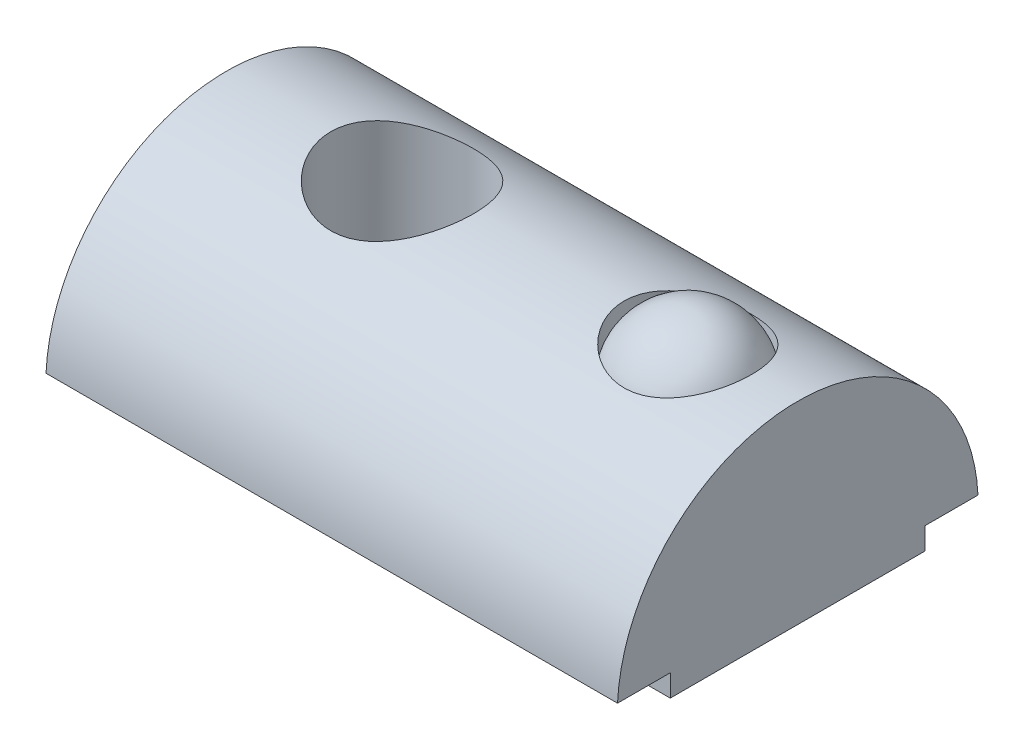
from build123d import *

# Parameters (mm, degrees)
BOSS_EXTRUDE1_DEPTH = 13
TAP1_D              = 3.242
DIAMETERHOLE1_D     = 2.9
BOSS_EXTRUDE2_REACH = 13.082
SKETCH7_R           = 1.45


with BuildPart() as part:
    # Sketch1 → Boss-Extrude1 (new body)
    with BuildSketch(Plane(origin=(-4, 0, 0), x_dir=(0, 0, -1), z_dir=(1, 0, 0))):
        with BuildLine():
            Line((4.1, 0.5), (2.9, 0.5))
            Line((2.9, 0.5), (2.9, 0))
            Line((2.9, 0), (-2.9, 0))
            Line((-2.9, 0), (-2.9, 0.5))
            Line((-2.9, 0.5), (-4.1, 0.5))
            ThreePointArc((-4.1, 0.5), (0, 4.4), (4.1, 0.5))
        make_face()
    extrude(amount=BOSS_EXTRUDE1_DEPTH)

    # Tap1 (through all)
    with Locations(Plane(origin=(0, 0, 0), x_dir=(-1, 0, 0), z_dir=(0, -1, 0))):
        with Locations((0, 0)):
            Hole(TAP1_D / 2)

    # DiameterHole1 (through all)
    with Locations(Plane(origin=(0, 0, 0), x_dir=(-1, 0, 0), z_dir=(0, -1, 0))):
        with Locations((-6.5, 0)):
            Hole(DIAMETERHOLE1_D / 2)

    # Sketch4 → Revolve1 (revolve)
    with BuildSketch(Plane(origin=(0, 0, 0), x_dir=(-1, 0, 0), z_dir=(0, 0, -1))):
        with BuildLine():
            Line((-6.5, 5), (-6.5, 2))
            ThreePointArc((-6.5, 2), (-5, 3.5), (-6.5, 5))
        make_face()
    revolve(axis=Axis((6.5, 5, 0), (0, -1, 0)))

    # Sketch7 → Boss-Extrude2 (add, up to next)
    with BuildSketch(Plane.XZ, mode=Mode.PRIVATE) as boss_extrude2_sk1:
        with Locations((6.5, 0)):
            Circle(SKETCH7_R)
    boss_extrude2_tool1 = extrude(boss_extrude2_sk1.sketch, amount=-BOSS_EXTRUDE2_REACH, mode=Mode.PRIVATE) - part.part
    add(boss_extrude2_tool1.solids().sort_by_distance((6.5, 0, 0))[0])


solid = part.part
